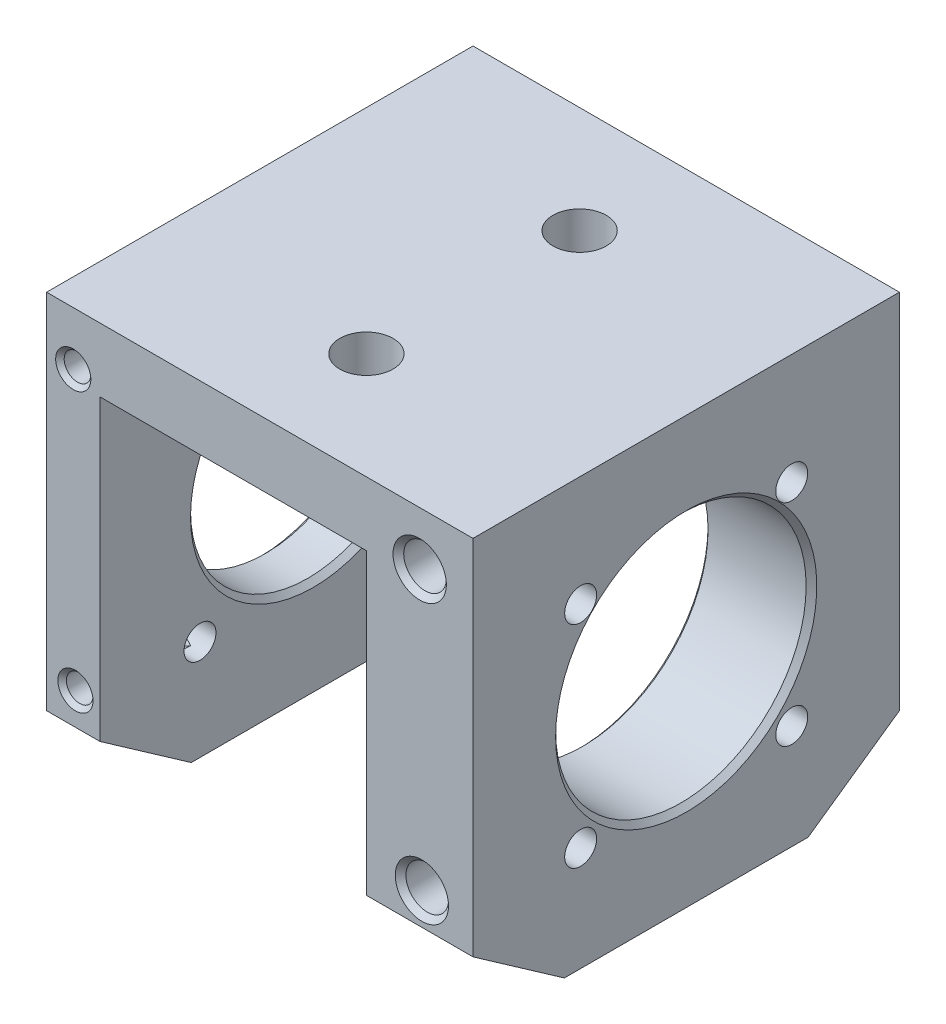
from build123d import *

# Parameters (mm, degrees)
SKETCH_1_W          = 40
SKETCH_1_H          = 40
EXTRUDE_1_DEPTH     = 6
SKETCH_1_3_W        = 5
SKETCH_1_3_H        = 40
SKETCH_1_3_W_2      = 10
EXTRUDE_2_DEPTH     = 34
CUT_EXTRUDE_1_DEPTH = 20
CUT_EXTRUDE_2_REACH = 50.99
SKETCH_4_R          = 2.5
SKETCH_5_R          = 1.5
CUT_EXTRUDE_3_DEPTH = 5
CUT_EXTRUDE_4_REACH = 51.558
SKETCH_7_R          = 1.5
CUT_EXTRUDE_5_REACH = 58.178
SKETCH_8_R          = 11.75
CUT_EXTRUDE_6_REACH = 58.178
SKETCH_9_R          = 11
CHAMFER_1_SIZE      = 0.5
CHAMFER_2_SIZE      = 0.3
CHAMFER_3_SIZE      = 0.5
CHAMFER_4_SIZE      = 0.5
CHAMFER_5_SIZE      = 0.5
CHAMFER_6_SIZE      = 0.5
CHAMFER_7_SIZE      = 0.4
CHAMFER_8_SIZE      = 0.4
CHAMFER_9_SIZE      = 0.5
CHAMFER_10_SIZE     = 0.5
CHAMFER_11_SIZE     = 0.4
CHAMFER_12_SIZE     = 0.4


# Read off the part's stored shape, not the designer's step: 高级异型孔6, 高级异型孔7, 镜向4
with BuildPart() as part:
    # 草图1 → 凸台-拉伸1 (new body)
    with BuildSketch(Plane(origin=(0, 0, 0), x_dir=(1, 0, 0), z_dir=(0, 1, 0))):
        Rectangle(SKETCH_1_W, SKETCH_1_H)
    extrude(amount=EXTRUDE_1_DEPTH)

    # 草图1<3> → 凸台-拉伸2 (add)
    with BuildSketch(Plane(origin=(0, 0, 0), x_dir=(1, 0, 0), z_dir=(0, 1, 0))):
        with Locations((-17.5, 0)):
            Rectangle(SKETCH_1_3_W, SKETCH_1_3_H)
        with Locations((15, 0)):
            Rectangle(SKETCH_1_3_W_2, SKETCH_1_3_H)
    extrude(amount=-EXTRUDE_2_DEPTH)

    # 草图3 → 切除-拉伸1 (cut, symmetric)
    with BuildSketch(Plane(origin=(0, 0, 0), x_dir=(0, 0, -1), z_dir=(1, 0, 0))):
        Polygon((20, -28), (11.43111196, -34), (20, -34), align=None)
        Polygon((-20, -34), (-20, -28), (-11.43111196, -34), align=None)
    extrude(amount=CUT_EXTRUDE_1_DEPTH, both=True, mode=Mode.SUBTRACT)

    # 草图4 → 切除-拉伸2 (cut, up to next)
    with BuildSketch(Plane(origin=(0, 6, 0), x_dir=(1, 0, 0), z_dir=(0, 1, 0)), mode=Mode.PRIVATE) as cut_extrude_2_sk1:
        with Locations(Location((0, -10, 0), (0, 0, 270))):
            Circle(SKETCH_4_R)
    cut_extrude_2_tool1 = extrude(cut_extrude_2_sk1.sketch, amount=-CUT_EXTRUDE_2_REACH, mode=Mode.PRIVATE) & part.part
    # 草图4 → 切除-拉伸2 (cut, up to next)
    with BuildSketch(Plane(origin=(0, 6, 0), x_dir=(1, 0, 0), z_dir=(0, 1, 0)), mode=Mode.PRIVATE) as cut_extrude_2_sk2:
        with Locations(Location((0, 10, 0), (0, 0, 270))):
            Circle(SKETCH_4_R)
    cut_extrude_2_tool2 = extrude(cut_extrude_2_sk2.sketch, amount=-CUT_EXTRUDE_2_REACH, mode=Mode.PRIVATE) & part.part
    add(cut_extrude_2_tool1.solids().sort_by_distance((0, 6, 10))[0], mode=Mode.SUBTRACT)
    add(cut_extrude_2_tool2.solids().sort_by_distance((0, 6, -10))[0], mode=Mode.SUBTRACT)

    # 草图5 → 切除-拉伸3 (cut)
    with BuildSketch(Plane(origin=(-15, 0, 0), x_dir=(0, 0, -1), z_dir=(1, 0, 0))):
        with Locations((-10.61, -3.39)):
            Circle(SKETCH_5_R)
        with Locations((-10.61, -24.6)):
            Circle(SKETCH_5_R)
        with Locations((10.6, -24.6)):
            Circle(SKETCH_5_R)
        with Locations((10.6, -3.39)):
            Circle(SKETCH_5_R)
    extrude(amount=-CUT_EXTRUDE_3_DEPTH, mode=Mode.SUBTRACT)

    # 草图7 → 切除-拉伸4 (cut, up to next)
    with BuildSketch(Plane.ZY.offset(-10), mode=Mode.PRIVATE) as cut_extrude_4_sk1:
        with Locations((9.9, -4.39)):
            Circle(SKETCH_7_R)
    cut_extrude_4_tool1 = extrude(cut_extrude_4_sk1.sketch, amount=-CUT_EXTRUDE_4_REACH, mode=Mode.PRIVATE) & part.part
    # 草图7 → 切除-拉伸4 (cut, up to next)
    with BuildSketch(Plane.ZY.offset(-10), mode=Mode.PRIVATE) as cut_extrude_4_sk2:
        with Locations((9.9, -24.19)):
            Circle(SKETCH_7_R)
    cut_extrude_4_tool2 = extrude(cut_extrude_4_sk2.sketch, amount=-CUT_EXTRUDE_4_REACH, mode=Mode.PRIVATE) & part.part
    # 草图7 → 切除-拉伸4 (cut, up to next)
    with BuildSketch(Plane.ZY.offset(-10), mode=Mode.PRIVATE) as cut_extrude_4_sk3:
        with Locations((-9.9, -24.19)):
            Circle(SKETCH_7_R)
    cut_extrude_4_tool3 = extrude(cut_extrude_4_sk3.sketch, amount=-CUT_EXTRUDE_4_REACH, mode=Mode.PRIVATE) & part.part
    # 草图7 → 切除-拉伸4 (cut, up to next)
    with BuildSketch(Plane.ZY.offset(-10), mode=Mode.PRIVATE) as cut_extrude_4_sk4:
        with Locations((-9.9, -4.39)):
            Circle(SKETCH_7_R)
    cut_extrude_4_tool4 = extrude(cut_extrude_4_sk4.sketch, amount=-CUT_EXTRUDE_4_REACH, mode=Mode.PRIVATE) & part.part
    add(cut_extrude_4_tool1.solids().sort_by_distance((10, -4.39, 9.9))[0], mode=Mode.SUBTRACT)
    add(cut_extrude_4_tool2.solids().sort_by_distance((10, -24.19, 9.9))[0], mode=Mode.SUBTRACT)
    add(cut_extrude_4_tool3.solids().sort_by_distance((10, -24.19, -9.9))[0], mode=Mode.SUBTRACT)
    add(cut_extrude_4_tool4.solids().sort_by_distance((10, -4.39, -9.9))[0], mode=Mode.SUBTRACT)

    # 草图8 → 切除-拉伸5 (cut, up to next)
    with BuildSketch(Plane(origin=(20, 0, 0), x_dir=(0, 0, -1), z_dir=(1, 0, 0)), mode=Mode.PRIVATE) as cut_extrude_5_sk1:
        with Locations((0, -14)):
            Circle(SKETCH_8_R)
    cut_extrude_5_tool1 = extrude(cut_extrude_5_sk1.sketch, amount=-CUT_EXTRUDE_5_REACH, mode=Mode.PRIVATE) & part.part
    add(cut_extrude_5_tool1.solids().sort_by_distance((20, -14, 0))[0], mode=Mode.SUBTRACT)

    # 草图9 → 切除-拉伸6 (cut, up to next)
    with BuildSketch(Plane.ZY.offset(20), mode=Mode.PRIVATE) as cut_extrude_6_sk1:
        with Locations((0, -14)):
            Circle(SKETCH_9_R)
    cut_extrude_6_tool1 = extrude(cut_extrude_6_sk1.sketch, amount=-CUT_EXTRUDE_6_REACH, mode=Mode.PRIVATE) & part.part
    add(cut_extrude_6_tool1.solids().sort_by_distance((-20, -14, 0))[0], mode=Mode.SUBTRACT)

    # 倒角1
    chamfer_1_edges = [part.edges().sort_by_distance(p)[0] for p in [
        (20, -14, 11.75),
    ]]
    chamfer(chamfer_1_edges, length=CHAMFER_1_SIZE)

    # 倒角2
    chamfer_2_edges = [part.edges().sort_by_distance(p)[0] for p in [
        (10, -14, 11.75),
    ]]
    chamfer(chamfer_2_edges, length=CHAMFER_2_SIZE)

    # 倒角3
    chamfer_3_edges = [part.edges().sort_by_distance(p)[0] for p in [
        (-20, -14, -11),
    ]]
    chamfer(chamfer_3_edges, length=CHAMFER_3_SIZE)

    # 倒角4
    chamfer_4_edges = [part.edges().sort_by_distance(p)[0] for p in [
        (-15, -14, -11),
    ]]
    chamfer(chamfer_4_edges, length=CHAMFER_4_SIZE)

    # 高级异型孔6 outline → 高级异型孔6 (revolve, cut)
    with BuildSketch(Plane(origin=(-17.29366154, -25.01, 0), x_dir=(1, 0, 0), z_dir=(0, -1, 0))):
        Polygon((0, -20), (1.250000655, -20), (1.25, -10), (0.81997305, -9.741613741), (0, -9.741613741), align=None)
    revolve(axis=Axis((-17.29366154, -25.01, 0), (0, 0, 1)), mode=Mode.SUBTRACT)

    # Other 6 2 outline → Other 6 2 (revolve, cut)
    with BuildSketch(Plane(origin=(-17.5, 0.99, 0), x_dir=(1, 0, 0), z_dir=(0, -1, 0))):
        Polygon((1.25, -20), (1.25, -10), (0, -9.248924226), (0, -20), align=None)
    revolve(axis=Axis((-17.5, 0.99, 0), (0, 0, 1)), mode=Mode.SUBTRACT)

    # 高级异型孔7 outline → 高级异型孔7 (revolve, cut)
    with BuildSketch(Plane(origin=(15, 0.99, 0), x_dir=(1, 0, 0), z_dir=(0, -1, 0))):
        Polygon((2, -20), (2, -10), (0, -8.798278762), (0, -20), align=None)
    revolve(axis=Axis((15, 0.99, 0), (0, 0, 1)), mode=Mode.SUBTRACT)

    # Other 7 2 outline → Other 7 2 (revolve, cut)
    with BuildSketch(Plane(origin=(15.20633846, -25.01, 0), x_dir=(1, 0, 0), z_dir=(0, -1, 0))):
        Polygon((2, -20), (2, -10), (0.412753929, -9.046286343), (0, -9.046286343), (0, -20), align=None)
    revolve(axis=Axis((15.20633846, -25.01, 0), (0, 0, 1)), mode=Mode.SUBTRACT)

    # 倒角5
    chamfer_5_edges = [part.edges().sort_by_distance(p)[0] for p in [
        (13, 0.99, -20),
    ]]
    chamfer(chamfer_5_edges, length=CHAMFER_5_SIZE)

    # 倒角6
    chamfer_6_edges = [part.edges().sort_by_distance(p)[0] for p in [
        (13.20633846, -25.01, -20),
    ]]
    chamfer(chamfer_6_edges, length=CHAMFER_6_SIZE)

    # 倒角7
    chamfer_7_edges = [part.edges().sort_by_distance(p)[0] for p in [
        (-18.543662195, -25.01, -20),
    ]]
    chamfer(chamfer_7_edges, length=CHAMFER_7_SIZE)

    # 倒角8
    chamfer_8_edges = [part.edges().sort_by_distance(p)[0] for p in [
        (-18.75, 0.99, -20),
    ]]
    chamfer(chamfer_8_edges, length=CHAMFER_8_SIZE)

    # 镜向4 outline → 镜向4 (revolve, cut)
    with BuildSketch(Plane(origin=(-17.29366154, -25.01, 0), x_dir=(1, 0, 0), z_dir=(0, -1, 0))):
        Polygon((0.807641167, 9.734203998), (1.25, 10), (1.25, 20), (0, 20), (0, 9.734203998), align=None)
    revolve(axis=Axis((-17.29366154, -25.01, 0), (0, 0, 1)), mode=Mode.SUBTRACT)

    # Mirror 4 2 outline → Mirror 4 2 (revolve, cut)
    with BuildSketch(Plane(origin=(-17.5, 0.99, 0), x_dir=(1, 0, 0), z_dir=(0, -1, 0))):
        Polygon((0, 9.248924226), (1.25, 10), (1.25, 20), (0, 20), align=None)
    revolve(axis=Axis((-17.5, 0.99, 0), (0, 0, 1)), mode=Mode.SUBTRACT)

    # Mirror 4 3 outline → Mirror 4 3 (revolve, cut)
    with BuildSketch(Plane(origin=(15, 0.99, 0), x_dir=(1, 0, 0), z_dir=(0, -1, 0))):
        Polygon((0, 8.798278762), (2, 10), (2, 20), (0, 20), align=None)
    revolve(axis=Axis((15, 0.99, 0), (0, 0, 1)), mode=Mode.SUBTRACT)

    # Mirror 4 4 outline → Mirror 4 4 (revolve, cut)
    with BuildSketch(Plane(origin=(15.20633846, -25.01, 0), x_dir=(1, 0, 0), z_dir=(0, -1, 0))):
        Polygon((0.412753929, 9.046286343), (2, 10), (2, 20), (0, 20), (0, 9.046286343), align=None)
    revolve(axis=Axis((15.20633846, -25.01, 0), (0, 0, 1)), mode=Mode.SUBTRACT)

    # 倒角9
    chamfer_9_edges = [part.edges().sort_by_distance(p)[0] for p in [
        (13.20633846, -25.01, 20),
    ]]
    chamfer(chamfer_9_edges, length=CHAMFER_9_SIZE)

    # 倒角10
    chamfer_10_edges = [part.edges().sort_by_distance(p)[0] for p in [
        (13, 0.99, 20),
    ]]
    chamfer(chamfer_10_edges, length=CHAMFER_10_SIZE)

    # 倒角11
    chamfer_11_edges = [part.edges().sort_by_distance(p)[0] for p in [
        (-18.54366154, -25.01, 20),
    ]]
    chamfer(chamfer_11_edges, length=CHAMFER_11_SIZE)

    # 倒角12
    chamfer_12_edges = [part.edges().sort_by_distance(p)[0] for p in [
        (-18.75, 0.99, 20),
    ]]
    chamfer(chamfer_12_edges, length=CHAMFER_12_SIZE)


solid = part.part
